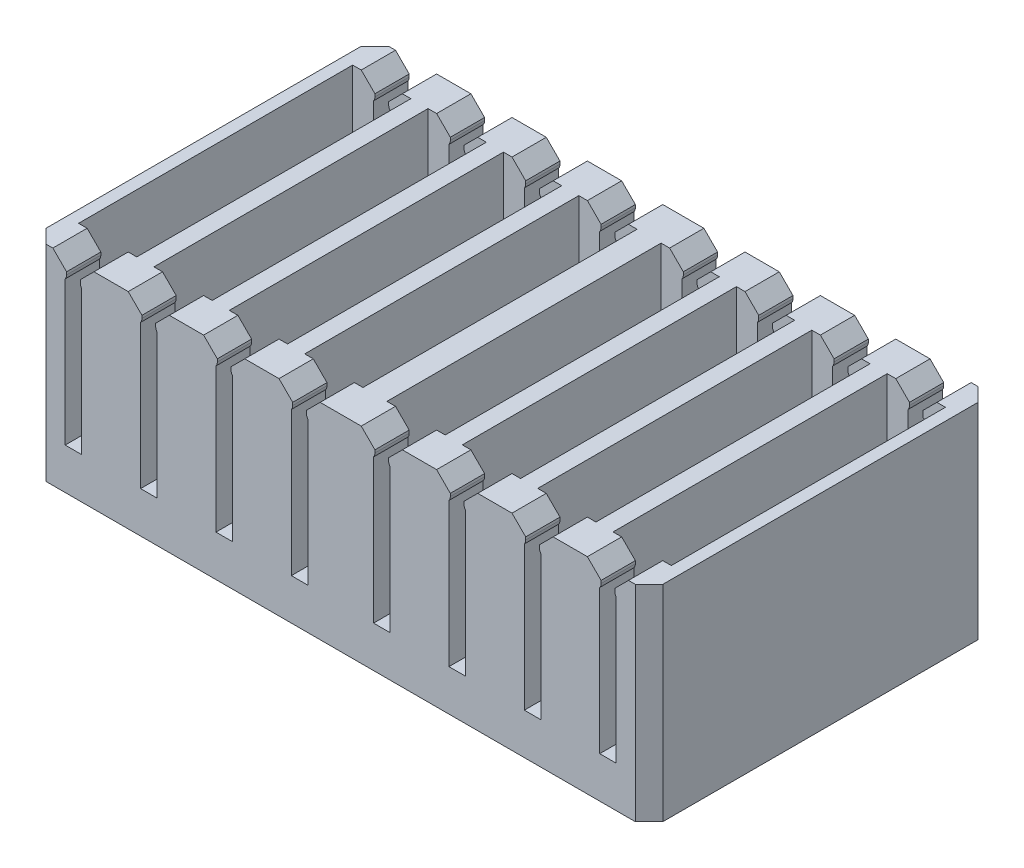
from build123d import *

# Parameters (mm, degrees)
SKETCH2_W               = 45
SKETCH2_H               = 25
BOSS_EXTRUDE1_DEPTH     = 15
CUT_EXTRUDE1_REACH      = 38.827
SKETCH4_W               = 0.1
SKETCH4_H               = 10.5
LPATTERN1_COUNT         = 4
LPATTERN1_PITCH         = 5.5
MIRROR1_COPY_1_REACH    = 38.827
MIRROR1_COPY_1_SKETCH_W = 0.1
MIRROR1_COPY_1_SKETCH_H = 10.5
MIRROR1_COPY_2_REACH    = 38.827
MIRROR1_COPY_2_SKETCH_W = 0.1
MIRROR1_COPY_2_SKETCH_H = 10.5
MIRROR1_COPY_3_REACH    = 38.827
MIRROR1_COPY_3_SKETCH_W = 0.1
MIRROR1_COPY_3_SKETCH_H = 10.5
SKETCH9_W               = 4.25
SKETCH9_H               = 20
CUT_EXTRUDE3_DEPTH      = 12
LPATTERN2_COUNT         = 4
LPATTERN2_PITCH         = 5.5
MIRROR2_COPY_1_SKETCH_W = 4.25
MIRROR2_COPY_1_SKETCH_H = 20
MIRROR2_COPY_1_DEPTH    = 12
MIRROR2_COPY_2_SKETCH_W = 4.25
MIRROR2_COPY_2_SKETCH_H = 20
MIRROR2_COPY_2_DEPTH    = 12
MIRROR2_COPY_3_SKETCH_W = 4.25
MIRROR2_COPY_3_SKETCH_H = 20
MIRROR2_COPY_3_DEPTH    = 12
CHAMFER1_SIZE           = 1
CHAMFER2_SIZE           = 1
FILLET1_R               = 0.5
SKETCH10_R              = 6.11
BOSS_EXTRUDE2_DEPTH     = 3.5
FILLET2_R               = 1


with BuildPart() as part:
    # Sketch2 → Boss-Extrude1 (new body)
    with BuildSketch(Plane(origin=(0, 0, 0), x_dir=(1, 0, 0), z_dir=(0, 1, 0))):
        Rectangle(SKETCH2_W, SKETCH2_H)
    extrude(amount=BOSS_EXTRUDE1_DEPTH)

    # Sketch4 → Cut-Extrude1 (cut, up to next)
    with BuildSketch(Plane.XY.offset(12.5), mode=Mode.PRIVATE) as cut_extrude1_sk1:
        Polygon((-19, 15), (-20, 15), (-20, 13.5), (-20, 3), (-19, 3), (-19, 13.5), align=None)
    cut_extrude1_tool1 = extrude(cut_extrude1_sk1.sketch, amount=-CUT_EXTRUDE1_REACH, mode=Mode.PRIVATE) & part.part
    # Sketch4 → Cut-Extrude1 (cut, up to next)
    with BuildSketch(Plane.XY.offset(12.5), mode=Mode.PRIVATE) as cut_extrude1_sk2:
        with Locations((-20.05, 8.25)):
            Rectangle(SKETCH4_W, SKETCH4_H)
    cut_extrude1_tool2 = extrude(cut_extrude1_sk2.sketch, amount=-CUT_EXTRUDE1_REACH, mode=Mode.PRIVATE) & part.part
    # Sketch4 → Cut-Extrude1 (cut, up to next)
    with BuildSketch(Plane.XY.offset(12.5), mode=Mode.PRIVATE) as cut_extrude1_sk3:
        with Locations((-18.95, 8.25)):
            Rectangle(SKETCH4_W, SKETCH4_H)
    cut_extrude1_tool3 = extrude(cut_extrude1_sk3.sketch, amount=-CUT_EXTRUDE1_REACH, mode=Mode.PRIVATE) & part.part
    cut_extrude1_1 = cut_extrude1_tool1.solids().sort_by_distance((-19.5, 9, 12.5))[0]
    add(cut_extrude1_1, mode=Mode.SUBTRACT)
    cut_extrude1_2 = cut_extrude1_tool2.solids().sort_by_distance((-20.05, 8.25, 12.5))[0]
    add(cut_extrude1_2, mode=Mode.SUBTRACT)
    cut_extrude1_3 = cut_extrude1_tool3.solids().sort_by_distance((-18.95, 8.25, 12.5))[0]
    add(cut_extrude1_3, mode=Mode.SUBTRACT)
    cut_extrude1 = cut_extrude1_1 + cut_extrude1_2 + cut_extrude1_3  # Cut-Extrude1 as one shape, for the pattern or mirror that repeats it

    # LPattern1: Cut-Extrude1 ×4
    with Locations(*[(i * LPATTERN1_PITCH, 0, 0) for i in range(1, LPATTERN1_COUNT)]):
        add(cut_extrude1, mode=Mode.SUBTRACT)

    # Mirror1: Cut-Extrude1 across plane
    add(cut_extrude1.mirror(Plane(origin=(0, 0, 0), x_dir=(0, 0, 1), z_dir=(1, 0, 0))), mode=Mode.SUBTRACT)

    # Mirror1 copy 1 sketch → Mirror1 copy 1 (cut, up to next)
    with BuildSketch(Plane(origin=(-5.5, 0, 12.5), x_dir=(-1, 0, 0), z_dir=(0, 0, 1)), mode=Mode.PRIVATE) as mirror1_copy_1_sk1:
        Polygon((-19, -15), (-20, -15), (-20, -13.5), (-20, -3), (-19, -3), (-19, -13.5), align=None)
    mirror1_copy_1_tool1 = extrude(mirror1_copy_1_sk1.sketch, amount=-MIRROR1_COPY_1_REACH, mode=Mode.PRIVATE) & part.part
    # Mirror1 copy 1 sketch → Mirror1 copy 1 (cut, up to next)
    with BuildSketch(Plane(origin=(-5.5, 0, 12.5), x_dir=(-1, 0, 0), z_dir=(0, 0, 1)), mode=Mode.PRIVATE) as mirror1_copy_1_sk2:
        with Locations((-20.05, -8.25)):
            Rectangle(MIRROR1_COPY_1_SKETCH_W, MIRROR1_COPY_1_SKETCH_H)
    mirror1_copy_1_tool2 = extrude(mirror1_copy_1_sk2.sketch, amount=-MIRROR1_COPY_1_REACH, mode=Mode.PRIVATE) & part.part
    # Mirror1 copy 1 sketch → Mirror1 copy 1 (cut, up to next)
    with BuildSketch(Plane(origin=(-5.5, 0, 12.5), x_dir=(-1, 0, 0), z_dir=(0, 0, 1)), mode=Mode.PRIVATE) as mirror1_copy_1_sk3:
        with Locations((-18.95, -8.25)):
            Rectangle(MIRROR1_COPY_1_SKETCH_W, MIRROR1_COPY_1_SKETCH_H)
    mirror1_copy_1_tool3 = extrude(mirror1_copy_1_sk3.sketch, amount=-MIRROR1_COPY_1_REACH, mode=Mode.PRIVATE) & part.part
    add(mirror1_copy_1_tool1.solids().sort_by_distance((14, 9, 12.5))[0], mode=Mode.SUBTRACT)
    add(mirror1_copy_1_tool2.solids().sort_by_distance((14.55, 8.25, 12.5))[0], mode=Mode.SUBTRACT)
    add(mirror1_copy_1_tool3.solids().sort_by_distance((13.45, 8.25, 12.5))[0], mode=Mode.SUBTRACT)

    # Mirror1 copy 2 sketch → Mirror1 copy 2 (cut, up to next)
    with BuildSketch(Plane(origin=(-11, 0, 12.5), x_dir=(-1, 0, 0), z_dir=(0, 0, 1)), mode=Mode.PRIVATE) as mirror1_copy_2_sk1:
        Polygon((-19, -15), (-20, -15), (-20, -13.5), (-20, -3), (-19, -3), (-19, -13.5), align=None)
    mirror1_copy_2_tool1 = extrude(mirror1_copy_2_sk1.sketch, amount=-MIRROR1_COPY_2_REACH, mode=Mode.PRIVATE) & part.part
    # Mirror1 copy 2 sketch → Mirror1 copy 2 (cut, up to next)
    with BuildSketch(Plane(origin=(-11, 0, 12.5), x_dir=(-1, 0, 0), z_dir=(0, 0, 1)), mode=Mode.PRIVATE) as mirror1_copy_2_sk2:
        with Locations((-20.05, -8.25)):
            Rectangle(MIRROR1_COPY_2_SKETCH_W, MIRROR1_COPY_2_SKETCH_H)
    mirror1_copy_2_tool2 = extrude(mirror1_copy_2_sk2.sketch, amount=-MIRROR1_COPY_2_REACH, mode=Mode.PRIVATE) & part.part
    # Mirror1 copy 2 sketch → Mirror1 copy 2 (cut, up to next)
    with BuildSketch(Plane(origin=(-11, 0, 12.5), x_dir=(-1, 0, 0), z_dir=(0, 0, 1)), mode=Mode.PRIVATE) as mirror1_copy_2_sk3:
        with Locations((-18.95, -8.25)):
            Rectangle(MIRROR1_COPY_2_SKETCH_W, MIRROR1_COPY_2_SKETCH_H)
    mirror1_copy_2_tool3 = extrude(mirror1_copy_2_sk3.sketch, amount=-MIRROR1_COPY_2_REACH, mode=Mode.PRIVATE) & part.part
    add(mirror1_copy_2_tool1.solids().sort_by_distance((8.5, 9, 12.5))[0], mode=Mode.SUBTRACT)
    add(mirror1_copy_2_tool2.solids().sort_by_distance((9.05, 8.25, 12.5))[0], mode=Mode.SUBTRACT)
    add(mirror1_copy_2_tool3.solids().sort_by_distance((7.95, 8.25, 12.5))[0], mode=Mode.SUBTRACT)

    # Mirror1 copy 3 sketch → Mirror1 copy 3 (cut, up to next)
    with BuildSketch(Plane(origin=(-16.5, 0, 12.5), x_dir=(-1, 0, 0), z_dir=(0, 0, 1)), mode=Mode.PRIVATE) as mirror1_copy_3_sk1:
        Polygon((-19, -15), (-20, -15), (-20, -13.5), (-20, -3), (-19, -3), (-19, -13.5), align=None)
    mirror1_copy_3_tool1 = extrude(mirror1_copy_3_sk1.sketch, amount=-MIRROR1_COPY_3_REACH, mode=Mode.PRIVATE) & part.part
    # Mirror1 copy 3 sketch → Mirror1 copy 3 (cut, up to next)
    with BuildSketch(Plane(origin=(-16.5, 0, 12.5), x_dir=(-1, 0, 0), z_dir=(0, 0, 1)), mode=Mode.PRIVATE) as mirror1_copy_3_sk2:
        with Locations((-20.05, -8.25)):
            Rectangle(MIRROR1_COPY_3_SKETCH_W, MIRROR1_COPY_3_SKETCH_H)
    mirror1_copy_3_tool2 = extrude(mirror1_copy_3_sk2.sketch, amount=-MIRROR1_COPY_3_REACH, mode=Mode.PRIVATE) & part.part
    # Mirror1 copy 3 sketch → Mirror1 copy 3 (cut, up to next)
    with BuildSketch(Plane(origin=(-16.5, 0, 12.5), x_dir=(-1, 0, 0), z_dir=(0, 0, 1)), mode=Mode.PRIVATE) as mirror1_copy_3_sk3:
        with Locations((-18.95, -8.25)):
            Rectangle(MIRROR1_COPY_3_SKETCH_W, MIRROR1_COPY_3_SKETCH_H)
    mirror1_copy_3_tool3 = extrude(mirror1_copy_3_sk3.sketch, amount=-MIRROR1_COPY_3_REACH, mode=Mode.PRIVATE) & part.part
    add(mirror1_copy_3_tool1.solids().sort_by_distance((3, 9, 12.5))[0], mode=Mode.SUBTRACT)
    add(mirror1_copy_3_tool2.solids().sort_by_distance((3.55, 8.25, 12.5))[0], mode=Mode.SUBTRACT)
    add(mirror1_copy_3_tool3.solids().sort_by_distance((2.45, 8.25, 12.5))[0], mode=Mode.SUBTRACT)

    # Sketch9 → Cut-Extrude3 (cut)
    with BuildSketch(Plane(origin=(0, 15, 0), x_dir=(1, 0, 0), z_dir=(0, 1, 0))):
        with Locations((-19.5, 0)):
            Rectangle(SKETCH9_W, SKETCH9_H)
    cut_extrude3 = extrude(amount=-CUT_EXTRUDE3_DEPTH, mode=Mode.SUBTRACT)

    # LPattern2: Cut-Extrude3 ×4
    with Locations(*[(i * LPATTERN2_PITCH, 0, 0) for i in range(1, LPATTERN2_COUNT)]):
        add(cut_extrude3, mode=Mode.SUBTRACT)

    # Mirror2: Cut-Extrude3 across plane
    add(cut_extrude3.mirror(Plane(origin=(0, 0, 0), x_dir=(0, 0, 1), z_dir=(1, 0, 0))), mode=Mode.SUBTRACT)

    # Mirror2 copy 1 sketch → Mirror2 copy 1 (cut)
    with BuildSketch(Plane(origin=(-5.5, 15, 0), x_dir=(-1, 0, 0), z_dir=(0, 1, 0))):
        with Locations((-19.5, 0)):
            Rectangle(MIRROR2_COPY_1_SKETCH_W, MIRROR2_COPY_1_SKETCH_H)
    extrude(amount=-MIRROR2_COPY_1_DEPTH, mode=Mode.SUBTRACT)

    # Mirror2 copy 2 sketch → Mirror2 copy 2 (cut)
    with BuildSketch(Plane(origin=(-11, 15, 0), x_dir=(-1, 0, 0), z_dir=(0, 1, 0))):
        with Locations((-19.5, 0)):
            Rectangle(MIRROR2_COPY_2_SKETCH_W, MIRROR2_COPY_2_SKETCH_H)
    extrude(amount=-MIRROR2_COPY_2_DEPTH, mode=Mode.SUBTRACT)

    # Mirror2 copy 3 sketch → Mirror2 copy 3 (cut)
    with BuildSketch(Plane(origin=(-16.5, 15, 0), x_dir=(-1, 0, 0), z_dir=(0, 1, 0))):
        with Locations((-19.5, 0)):
            Rectangle(MIRROR2_COPY_3_SKETCH_W, MIRROR2_COPY_3_SKETCH_H)
    extrude(amount=-MIRROR2_COPY_3_DEPTH, mode=Mode.SUBTRACT)

    # Chamfer1
    chamfer1_edges = [part.edges().sort_by_distance(p)[0] for p in [
        (22.5, 7.5, 12.5),
        (-22.5, 7.5, 12.5),
        (-22.5, 7.5, -12.5),
        (22.5, 7.5, -12.5),
    ]]
    chamfer(chamfer1_edges, length=CHAMFER1_SIZE)

    # Chamfer2
    chamfer2_edges = [part.edges().sort_by_distance(p)[0] for p in [
        (3.5, 15, -11.25),
        (2.5, 15, -11.25),
        (14.5, 15, -11.25),
        (13.5, 15, -11.25),
        (9, 15, -11.25),
        (8, 15, -11.25),
        (20, 15, -11.25),
        (19, 15, -11.25),
        (-20, 15, 11.25),
        (-19, 15, 11.25),
        (-20, 15, -11.25),
        (-19, 15, -11.25),
        (-9, 15, 11.25),
        (-8, 15, 11.25),
        (-3.5, 15, 11.25),
        (-2.5, 15, 11.25),
        (-14.5, 15, 11.25),
        (-13.5, 15, 11.25),
        (2.5, 15, 11.25),
        (3.5, 15, 11.25),
        (13.5, 15, 11.25),
        (14.5, 15, 11.25),
        (8, 15, 11.25),
        (9, 15, 11.25),
        (19, 15, 11.25),
        (20, 15, 11.25),
        (-8, 15, -11.25),
        (-9, 15, -11.25),
        (-2.5, 15, -11.25),
        (-3.5, 15, -11.25),
        (-13.5, 15, -11.25),
        (-14.5, 15, -11.25),
    ]]
    chamfer(chamfer2_edges, length=CHAMFER2_SIZE)

    # Fillet1
    # the kernel refuses this fillet: 0.5 mm, written as the material it takes off along each edge
    with BuildSketch(Plane(origin=(-20, 13.5, -9.25), x_dir=(0, 1, 0), z_dir=(0, 0, -1)), Plane(origin=(-14.5, 13.5, -9.25), x_dir=(0, 1, 0), z_dir=(0, 0, -1)), Plane(origin=(-9, 13.5, -9.25), x_dir=(0, 1, 0), z_dir=(0, 0, -1)), Plane(origin=(-3.5, 13.5, -9.25), x_dir=(0, 1, 0), z_dir=(0, 0, -1)), Plane(origin=(-3.5, 13.5, 13.25), x_dir=(0, 1, 0), z_dir=(0, 0, -1)), Plane(origin=(-9, 13.5, 13.25), x_dir=(0, 1, 0), z_dir=(0, 0, -1)), Plane(origin=(-14.5, 13.5, 13.25), x_dir=(0, 1, 0), z_dir=(0, 0, -1)), Plane(origin=(-20, 13.5, 13.25), x_dir=(0, 1, 0), z_dir=(0, 0, -1))) as fillet1_piece_1:
        with BuildLine():
            CenterArc((0.3, -0.5), FILLET1_R, 90, 36.869897646)
            Line((0, -0.1), (-0.006, -0.092))
            ThreePointArc((-0.006, -0.092), (-0.01, -0.05), (-0.01, 0))
            Line((-0.01, 0), (0, 0.01))
            Line((0, 0.01), (0.3, 0.01))
            Line((0.3, 0.01), (0.3, 0))
        make_face()
    extrude(amount=4, mode=Mode.SUBTRACT)
    with BuildSketch(Plane(origin=(-19, 13.5, -9.25), x_dir=(1, 0, 0), z_dir=(0, 0, -1)), Plane(origin=(-13.5, 13.5, -9.25), x_dir=(1, 0, 0), z_dir=(0, 0, -1)), Plane(origin=(-8, 13.5, -9.25), x_dir=(1, 0, 0), z_dir=(0, 0, -1)), Plane(origin=(-2.5, 13.5, -9.25), x_dir=(1, 0, 0), z_dir=(0, 0, -1)), Plane(origin=(-2.5, 13.5, 13.25), x_dir=(1, 0, 0), z_dir=(0, 0, -1)), Plane(origin=(-8, 13.5, 13.25), x_dir=(1, 0, 0), z_dir=(0, 0, -1)), Plane(origin=(-13.5, 13.5, 13.25), x_dir=(1, 0, 0), z_dir=(0, 0, -1)), Plane(origin=(-19, 13.5, 13.25), x_dir=(1, 0, 0), z_dir=(0, 0, -1))) as fillet1_piece_2:
        with BuildLine():
            CenterArc((0.5, -0.3), FILLET1_R, 143.130102354, 36.869897646)
            Line((0, -0.3), (-0.01, -0.3))
            Line((-0.01, -0.3), (-0.01, 0))
            Line((-0.01, 0), (0, 0.01))
            ThreePointArc((0, 0.01), (0.05, 0.01), (0.092, 0.006))
            Line((0.092, 0.006), (0.1, 0))
        make_face()
    extrude(amount=4, mode=Mode.SUBTRACT)
    with BuildSketch(Plane(origin=(3.5, 13.5, -9.25), x_dir=(0, 1, 0), z_dir=(0, 0, -1)), Plane(origin=(9, 13.5, -9.25), x_dir=(0, 1, 0), z_dir=(0, 0, -1)), Plane(origin=(14.5, 13.5, -9.25), x_dir=(0, 1, 0), z_dir=(0, 0, -1)), Plane(origin=(20, 13.5, 13.25), x_dir=(0, 1, 0), z_dir=(0, 0, -1)), Plane(origin=(14.5, 13.5, 13.25), x_dir=(0, 1, 0), z_dir=(0, 0, -1)), Plane(origin=(9, 13.5, 13.25), x_dir=(0, 1, 0), z_dir=(0, 0, -1)), Plane(origin=(3.5, 13.5, 13.25), x_dir=(0, 1, 0), z_dir=(0, 0, -1))) as fillet1_piece_3:
        with BuildLine():
            CenterArc((0.3, 0.5), FILLET1_R, 233.130102354, 36.869897646)
            Line((0, 0.1), (-0.006, 0.092))
            ThreePointArc((-0.006, 0.092), (-0.01, 0.05), (-0.01, 0))
            Line((-0.01, 0), (0, -0.01))
            Line((0, -0.01), (0.3, -0.01))
            Line((0.3, -0.01), (0.3, 0))
        make_face()
    extrude(amount=4, mode=Mode.SUBTRACT)
    with BuildSketch(Plane(origin=(2.5, 13.5, -9.25), x_dir=(-1, 0, 0), z_dir=(0, 0, -1)), Plane(origin=(8, 13.5, -9.25), x_dir=(-1, 0, 0), z_dir=(0, 0, -1)), Plane(origin=(13.5, 13.5, -9.25), x_dir=(-1, 0, 0), z_dir=(0, 0, -1)), Plane(origin=(19, 13.5, -9.25), x_dir=(-1, 0, 0), z_dir=(0, 0, -1)), Plane(origin=(19, 13.5, 13.25), x_dir=(-1, 0, 0), z_dir=(0, 0, -1)), Plane(origin=(13.5, 13.5, 13.25), x_dir=(-1, 0, 0), z_dir=(0, 0, -1)), Plane(origin=(8, 13.5, 13.25), x_dir=(-1, 0, 0), z_dir=(0, 0, -1)), Plane(origin=(2.5, 13.5, 13.25), x_dir=(-1, 0, 0), z_dir=(0, 0, -1))) as fillet1_piece_4:
        with BuildLine():
            CenterArc((0.5, 0.3), FILLET1_R, 180, 36.869897646)
            Line((0, 0.3), (-0.01, 0.3))
            Line((-0.01, 0.3), (-0.01, 0))
            Line((-0.01, 0), (0, -0.01))
            ThreePointArc((0, -0.01), (0.05, -0.01), (0.092, -0.006))
            Line((0.092, -0.006), (0.1, 0))
        make_face()
    extrude(amount=4, mode=Mode.SUBTRACT)

    # Sketch10 → Boss-Extrude2 (add)
    with BuildSketch(Plane.XZ):
        with Locations(Location((-10, 0, 0), (0, 0, 90))):
            Circle(SKETCH10_R)
        with Locations(Location((10, 0, 0), (0, 0, 90))):
            Circle(SKETCH10_R)
    extrude(amount=BOSS_EXTRUDE2_DEPTH)

    # Fillet2
    fillet2_edges = [part.edges().sort_by_distance(p)[0] for p in [
        (-10, -3.5, -6.11),
        (10, -3.5, -6.11),
    ]]
    fillet(fillet2_edges, radius=FILLET2_R)


solid = part.part
